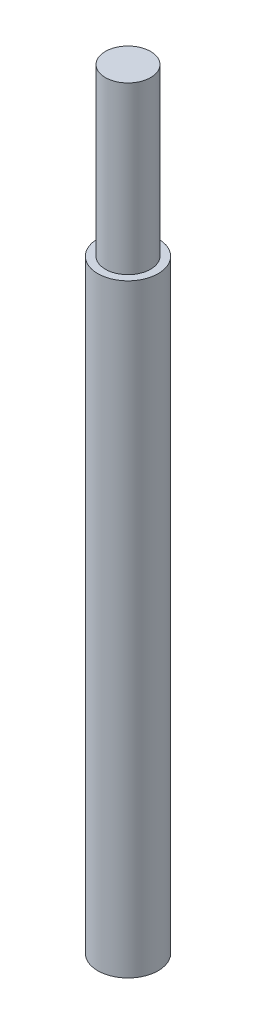
from build123d import *

# Parameters (mm, degrees)
SKETCH1_R           = 4
BOSS_EXTRUDE1_DEPTH = 80
SKETCH2_R           = 3
BOSS_EXTRUDE2_DEPTH = 22


with BuildPart() as part:
    # Sketch1 → Boss-Extrude1 (new body)
    with BuildSketch(Plane(origin=(0, 0, 0), x_dir=(1, 0, 0), z_dir=(0, 1, 0))):
        Circle(SKETCH1_R)
    extrude(amount=BOSS_EXTRUDE1_DEPTH)

    # Sketch2 → Boss-Extrude2 (add)
    with BuildSketch(Plane(origin=(0, 80, 0), x_dir=(1, 0, 0), z_dir=(0, 1, 0))):
        Circle(SKETCH2_R)
    extrude(amount=BOSS_EXTRUDE2_DEPTH)


solid = part.part
